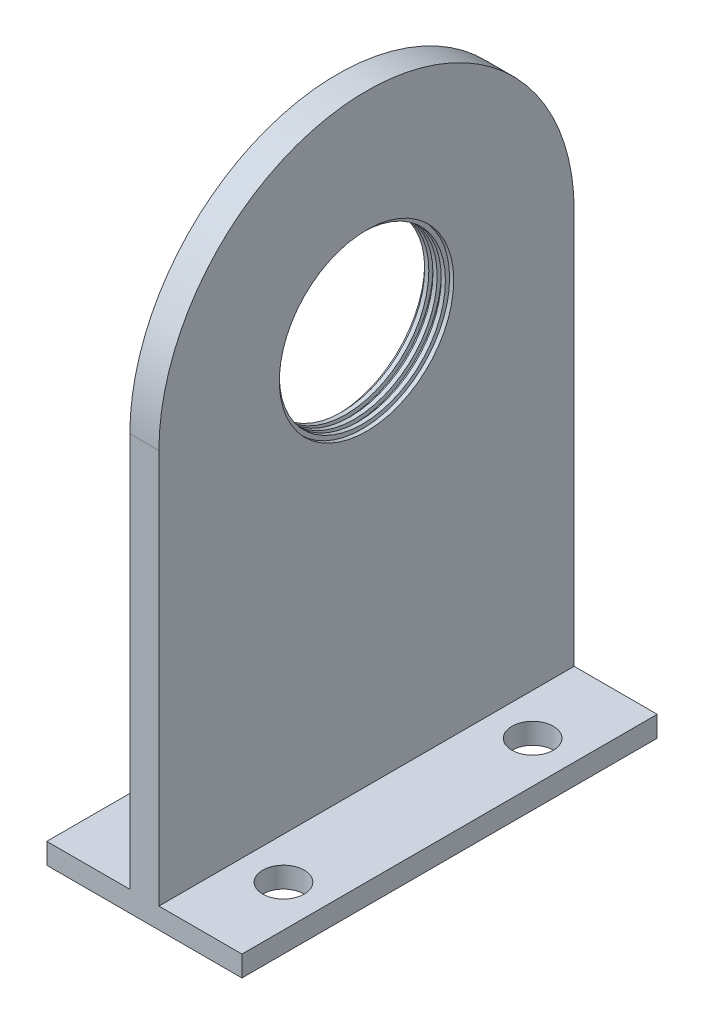
from build123d import *

# Parameters (mm, degrees)
SKETCH1_R                = 2
BOSS_EXTRUDE1_DEPTH      = 0.7
SKETCH2_R                = 2.1
CUT_EXTRUDE1_DEPTH       = 0.1
CUT_EXTRUDE2_START       = -0.1
SKETCH3_R                = 2.1
CUT_EXTRUDE2_DEPTH       = 0.1
CUT_EXTRUDE3_START       = -0.1
SKETCH4_R                = 2.1
CUT_EXTRUDE3_DEPTH       = 0.1
CUT_EXTRUDE4_START       = -0.1
SKETCH5_R                = 2.1
CUT_EXTRUDE4_DEPTH       = 0.1
BOSS_EXTRUDE2_DEPTH      = 2.7
BOSS_EXTRUDE2_DEPTH_BACK = 2
SKETCH6_W                = 10
SKETCH6_H                = 0.5
SKETCH7_R                = 0.5
CUT_EXTRUDE5_DEPTH       = 2.7
SKETCH8_R                = 0.5
CUT_EXTRUDE6_DEPTH       = 2.7


with BuildPart() as part:
    # Sketch1 → Boss-Extrude1 (new body)
    with BuildSketch(Plane(origin=(0, 0, 0), x_dir=(0, 0, -1), z_dir=(1, 0, 0))):
        with BuildLine():
            Line((-5, 0), (5, 0))
            Line((5, 0), (5, 10))
            ThreePointArc((5, 10), (0, 15), (-5, 10))
            Line((-5, 10), (-5, 0))
        make_face()
        with Locations((0, 10)):
            Circle(SKETCH1_R, mode=Mode.SUBTRACT)
    extrude(amount=BOSS_EXTRUDE1_DEPTH)

    # Sketch2 → Cut-Extrude1 (cut)
    with BuildSketch(Plane(origin=(0, 0, 0), x_dir=(0, 0, -1), z_dir=(1, 0, 0))):
        with Locations((0, 10)):
            Circle(SKETCH2_R)
    extrude(amount=CUT_EXTRUDE1_DEPTH, mode=Mode.SUBTRACT)

    # Sketch3 → Cut-Extrude2 (cut)
    with BuildSketch(Plane(origin=(0.7, 0, 0), x_dir=(0, 0, -1), z_dir=(1, 0, 0)).offset(CUT_EXTRUDE2_START)):
        with Locations((0, 10)):
            Circle(SKETCH3_R)
    extrude(amount=CUT_EXTRUDE2_DEPTH, mode=Mode.SUBTRACT)

    # Sketch4 → Cut-Extrude3 (cut)
    with BuildSketch(Plane(origin=(0.5, 0, 0), x_dir=(0, 0, -1), z_dir=(1, 0, 0)).offset(CUT_EXTRUDE3_START)):
        with Locations((0, 10)):
            Circle(SKETCH4_R)
    extrude(amount=CUT_EXTRUDE3_DEPTH, mode=Mode.SUBTRACT)

    # Sketch5 → Cut-Extrude4 (cut)
    with BuildSketch(Plane(origin=(0.3, 0, 0), x_dir=(0, 0, -1), z_dir=(1, 0, 0)).offset(CUT_EXTRUDE4_START)):
        with Locations((0, 10)):
            Circle(SKETCH5_R)
    extrude(amount=CUT_EXTRUDE4_DEPTH, mode=Mode.SUBTRACT)

    # Sketch6 → Boss-Extrude2 (add, two sides: drawn at the far end of the back side and taken through both)
    with BuildSketch(Plane(origin=(0, 0, 0), x_dir=(0, 0, -1), z_dir=(1, 0, 0)).offset(-BOSS_EXTRUDE2_DEPTH_BACK)):
        with Locations((0, 0.25)):
            Rectangle(SKETCH6_W, SKETCH6_H)
    extrude(amount=BOSS_EXTRUDE2_DEPTH + BOSS_EXTRUDE2_DEPTH_BACK)

    # Sketch7 → Cut-Extrude5 (cut)
    with BuildSketch(Plane(origin=(0, 0.5, 0), x_dir=(1, 0, 0), z_dir=(0, 1, 0))):
        with Locations((1.7, 3)):
            Circle(SKETCH7_R)
        with Locations((1.7, -3)):
            Circle(SKETCH7_R)
    extrude(amount=-CUT_EXTRUDE5_DEPTH, mode=Mode.SUBTRACT)

    # Sketch8 → Cut-Extrude6 (cut)
    with BuildSketch(Plane(origin=(0, 0.5, 0), x_dir=(1, 0, 0), z_dir=(0, 1, 0))):
        with Locations((-1, 3)):
            Circle(SKETCH8_R)
        with Locations((-1, -3)):
            Circle(SKETCH8_R)
    extrude(amount=-CUT_EXTRUDE6_DEPTH, mode=Mode.SUBTRACT)


solid = part.part
